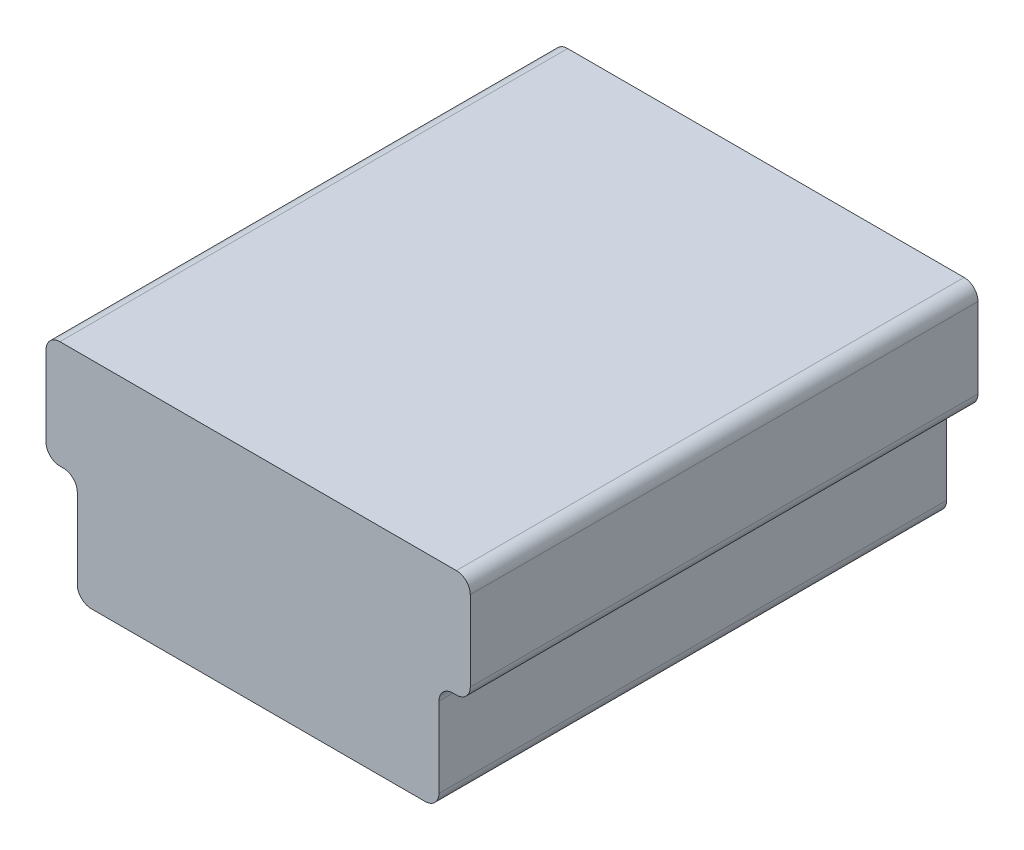
from build123d import *

# Parameters (mm, degrees)
SKETCH1_W           = 7.747
SKETCH1_H           = 9.271
BOSS_EXTRUDE1_DEPTH = 3.937
SKETCH2_W           = 0.5715
SKETCH2_H           = 1.9685
CUT_EXTRUDE1_DEPTH  = 11.791450887
SKETCH3_W           = 0.5715
SKETCH3_H           = 1.9685
CUT_EXTRUDE2_DEPTH  = 11.791450887
CUT_EXTRUDE3_DEPTH  = 8.89
SKETCH5_W           = 4.445
SKETCH5_H           = 1.524
BOSS_EXTRUDE2_DEPTH = 8.001
CHAMFER1_SIZE       = 0.508000102
FILLET1_R           = 0.254


with BuildPart() as part:
    # Sketch1 → Boss-Extrude1 (new body)
    with BuildSketch(Plane.XZ):
        with Locations((0, 4.6355)):
            Rectangle(SKETCH1_W, SKETCH1_H)
    extrude(amount=-BOSS_EXTRUDE1_DEPTH)

    # Sketch2 → Cut-Extrude1 (cut, through all)
    with BuildSketch(Plane(origin=(0, 0, 0), x_dir=(-1, 0, 0), z_dir=(0, 0, -1))):
        with Locations((-3.58775, 0.98425)):
            Rectangle(SKETCH2_W, SKETCH2_H)
    extrude(amount=-CUT_EXTRUDE1_DEPTH, mode=Mode.SUBTRACT)

    # Sketch3 → Cut-Extrude2 (cut, through all)
    with BuildSketch(Plane(origin=(0, 0, 0), x_dir=(-1, 0, 0), z_dir=(0, 0, -1))):
        with Locations((3.58775, 0.98425)):
            Rectangle(SKETCH3_W, SKETCH3_H)
    extrude(amount=-CUT_EXTRUDE2_DEPTH, mode=Mode.SUBTRACT)

    # Sketch4 → Cut-Extrude3 (cut)
    with BuildSketch(Plane(origin=(0, 0, 0), x_dir=(-1, 0, 0), z_dir=(0, 0, -1))):
        with BuildLine():
            Line((3.4925, 2.346317023), (3.4925, 3.556))
            Line((3.4925, 3.556), (-3.4925, 3.556))
            Line((-3.4925, 3.556), (-3.4925, 2.346317023))
            ThreePointArc((-3.4925, 2.346317023), (-3.085071396, 2.14047095), (-2.921, 1.7145))
            Line((-2.921, 1.7145), (-2.921, 0.381))
            Line((-2.921, 0.381), (2.921, 0.381))
            Line((2.921, 0.381), (2.921, 1.7145))
            ThreePointArc((2.921, 1.7145), (3.085071396, 2.14047095), (3.4925, 2.346317023))
        make_face()
    extrude(amount=-CUT_EXTRUDE3_DEPTH, mode=Mode.SUBTRACT)

    # Sketch5 → Boss-Extrude2 (add)
    with BuildSketch(Plane(origin=(0, 0, 8.89), x_dir=(-1, 0, 0), z_dir=(0, 0, -1))):
        with Locations((0, 1.778)):
            Rectangle(SKETCH5_W, SKETCH5_H)
    extrude(amount=BOSS_EXTRUDE2_DEPTH)

    # Chamfer1
    chamfer1_edges = [part.edges().sort_by_distance(p)[0] for p in [
        (2.2225, 1.016, 4.8895),
        (-2.2225, 1.016, 4.8895),
    ]]
    chamfer(chamfer1_edges, length=CHAMFER1_SIZE)

    # Fillet1
    fillet1_edges = [part.edges().sort_by_distance(p)[0] for p in [
        (3.8735, 3.937, 4.6355),
        (3.8735, 1.9685, 4.6355),
        (-3.302, 0, 4.6355),
        (3.302, 1.9685, 4.6355),
        (-3.8735, 3.937, 4.6355),
        (-3.302, 1.9685, 4.6355),
        (3.302, 0, 4.6355),
        (-3.8735, 1.9685, 4.6355),
    ]]
    fillet(fillet1_edges, radius=FILLET1_R)


solid = part.part
